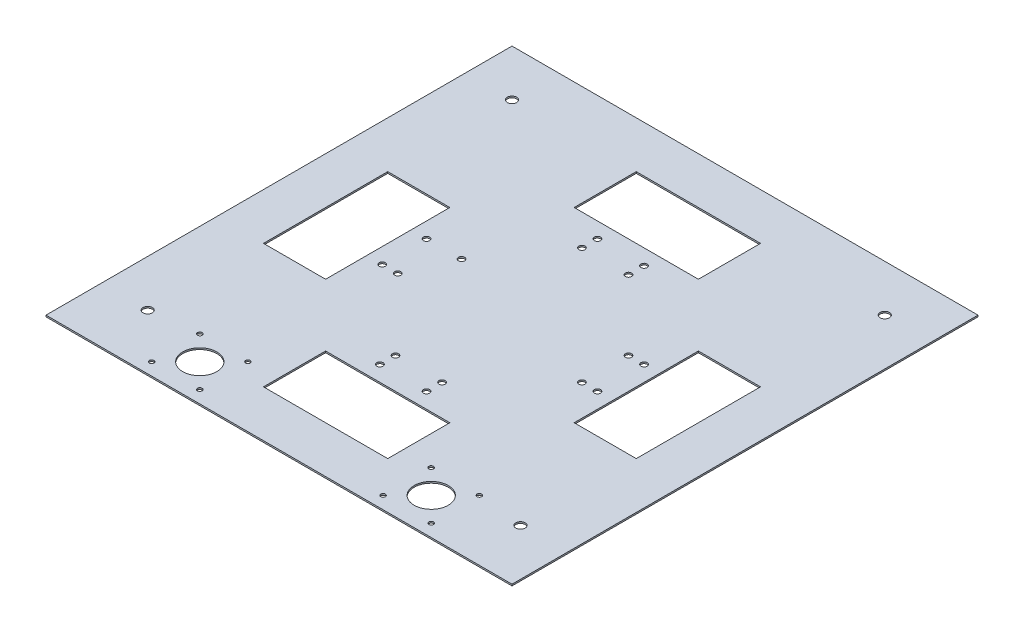
from build123d import *

# Parameters (mm, degrees)
SKETCH_1_W            = 300
SKETCH_1_H            = 300
EXTRUDE_1_DEPTH       = 1
EXTRUDE_2_OUTLINE_W   = 80
EXTRUDE_2_OUTLINE_H   = 40
EXTRUDE_2_OUTLINE_W_2 = 40
EXTRUDE_2_OUTLINE_H_2 = 80
EXTRUDE_2_DEPTH       = 1
SKETCH_3_R            = 3
CUT_EXTRUDE_6_DEPTH   = 359.144733033
SKETCH_4_R            = 2
CUT_EXTRUDE_7_DEPTH   = 359.144733033
SKETCH_5_R            = 1.5
SKETCH_5_R_2          = 11
CUT_EXTRUDE_8_DEPTH   = 359.144733033


# Read off the part's stored shape, not the designer's step: 凸台-拉伸2
with BuildPart() as part:
    # 草图1 → 凸台-拉伸1 (new body)
    with BuildSketch(Plane(origin=(0, 0, 0), x_dir=(1, 0, 0), z_dir=(0, 1, 0))):
        with Locations((91.102323194, -114.832625539)):
            Rectangle(SKETCH_1_W, SKETCH_1_H)
    extrude(amount=EXTRUDE_1_DEPTH)

    # 凸台-拉伸2 outline → 凸台-拉伸2 (cut)
    with BuildSketch(Plane(origin=(0, 0, 0), x_dir=(1, 0, 0), z_dir=(0, 1, 0))):
        with Locations((91.102323194, -14.832625539)):
            Rectangle(EXTRUDE_2_OUTLINE_W, EXTRUDE_2_OUTLINE_H)
        with Locations((91.102323194, -214.832625539)):
            Rectangle(EXTRUDE_2_OUTLINE_W, EXTRUDE_2_OUTLINE_H)
        with Locations((-8.897676806, -114.832625539)):
            Rectangle(EXTRUDE_2_OUTLINE_W_2, EXTRUDE_2_OUTLINE_H_2)
        with Locations((191.102323194, -114.832625539)):
            Rectangle(EXTRUDE_2_OUTLINE_W_2, EXTRUDE_2_OUTLINE_H_2)
    extrude(amount=EXTRUDE_2_DEPTH, mode=Mode.SUBTRACT)

    # 草图3 → 切除-拉伸6 (cut, through all)
    with BuildSketch(Plane(origin=(0, 0, 0), x_dir=(1, 0, 0), z_dir=(0, 1, 0))):
        with Locations(Location((-28.897676806, 5.167374461, 0), (0, 0, 270))):
            Circle(SKETCH_3_R)
        with Locations(Location((211.102323194, 5.167374461, 0), (0, 0, 270))):
            Circle(SKETCH_3_R)
        with Locations(Location((211.102323194, -229.359868174, 0), (0, 0, 270))):
            Circle(SKETCH_3_R)
        with Locations(Location((-28.897676806, -229.359868174, 0), (0, 0, 270))):
            Circle(SKETCH_3_R)
    extrude(amount=CUT_EXTRUDE_6_DEPTH, mode=Mode.SUBTRACT)

    # 草图4 → 切除-拉伸7 (cut, through all)
    with BuildSketch(Plane(origin=(0, 0, 0), x_dir=(1, 0, 0), z_dir=(0, 1, 0))):
        with Locations(Location((76.102323194, -184.832625539, 0), (0, 0, 270))):
            Circle(SKETCH_4_R)
        with Locations(Location((106.102323194, -184.832625539, 0), (0, 0, 270))):
            Circle(SKETCH_4_R)
        with Locations(Location((106.102323194, -174.832625539, 0), (0, 0, 270))):
            Circle(SKETCH_4_R)
        with Locations(Location((76.102323194, -174.832625539, 0), (0, 0, 270))):
            Circle(SKETCH_4_R)
        with Locations(Location((21.102323194, -99.832625539, 0), (0, 0, 270))):
            Circle(SKETCH_4_R)
        with Locations(Location((43.602323194, -99.832625539, 0), (0, 0, 270))):
            Circle(SKETCH_4_R)
        with Locations(Location((31.102323194, -128.332625539, 0), (0, 0, 270))):
            Circle(SKETCH_4_R)
        with Locations(Location((21.102323194, -128.332625539, 0), (0, 0, 270))):
            Circle(SKETCH_4_R)
        with Locations(Location((161.102323194, -99.832625539, 0), (0, 0, 270))):
            Circle(SKETCH_4_R)
        with Locations(Location((151.102323194, -99.832625539, 0), (0, 0, 270))):
            Circle(SKETCH_4_R)
        with Locations(Location((161.102323194, -129.832625539, 0), (0, 0, 270))):
            Circle(SKETCH_4_R)
        with Locations(Location((151.102323194, -129.832625539, 0), (0, 0, 270))):
            Circle(SKETCH_4_R)
        with Locations(Location((76.102323194, -44.832625539, 0), (0, 0, 270))):
            Circle(SKETCH_4_R)
        with Locations(Location((76.102323194, -54.832625539, 0), (0, 0, 270))):
            Circle(SKETCH_4_R)
        with Locations(Location((106.102323194, -54.832625539, 0), (0, 0, 270))):
            Circle(SKETCH_4_R)
        with Locations(Location((106.102323194, -44.832625539, 0), (0, 0, 270))):
            Circle(SKETCH_4_R)
    extrude(amount=CUT_EXTRUDE_7_DEPTH, mode=Mode.SUBTRACT)

    # 草图5 → 切除-拉伸8 (cut, through all)
    with BuildSketch(Plane(origin=(0, 0, 0), x_dir=(1, 0, 0), z_dir=(0, 1, 0))):
        with Locations(Location((150.102323194, -256.832625539, 0), (0, 0, 270))):
            Circle(SKETCH_5_R)
        with Locations(Location((181.102323194, -256.832625539, 0), (0, 0, 270))):
            Circle(SKETCH_5_R)
        with Locations(Location((150.102323194, -225.832625539, 0), (0, 0, 270))):
            Circle(SKETCH_5_R)
        with Locations(Location((181.102323194, -225.832625539, 0), (0, 0, 270))):
            Circle(SKETCH_5_R)
        with Locations(Location((1.102323194, -225.832625539, 0), (0, 0, 270))):
            Circle(SKETCH_5_R)
        with Locations(Location((32.102323194, -225.832625539, 0), (0, 0, 270))):
            Circle(SKETCH_5_R)
        with Locations(Location((32.102323194, -256.832625539, 0), (0, 0, 270))):
            Circle(SKETCH_5_R)
        with Locations(Location((1.102323194, -256.832625539, 0), (0, 0, 270))):
            Circle(SKETCH_5_R)
        with Locations(Location((16.602323194, -241.332625539, 0), (0, 0, 270))):
            Circle(SKETCH_5_R_2)
        with Locations(Location((165.602323194, -241.332625539, 0), (0, 0, 270))):
            Circle(SKETCH_5_R_2)
    extrude(amount=CUT_EXTRUDE_8_DEPTH, mode=Mode.SUBTRACT)


solid = part.part
